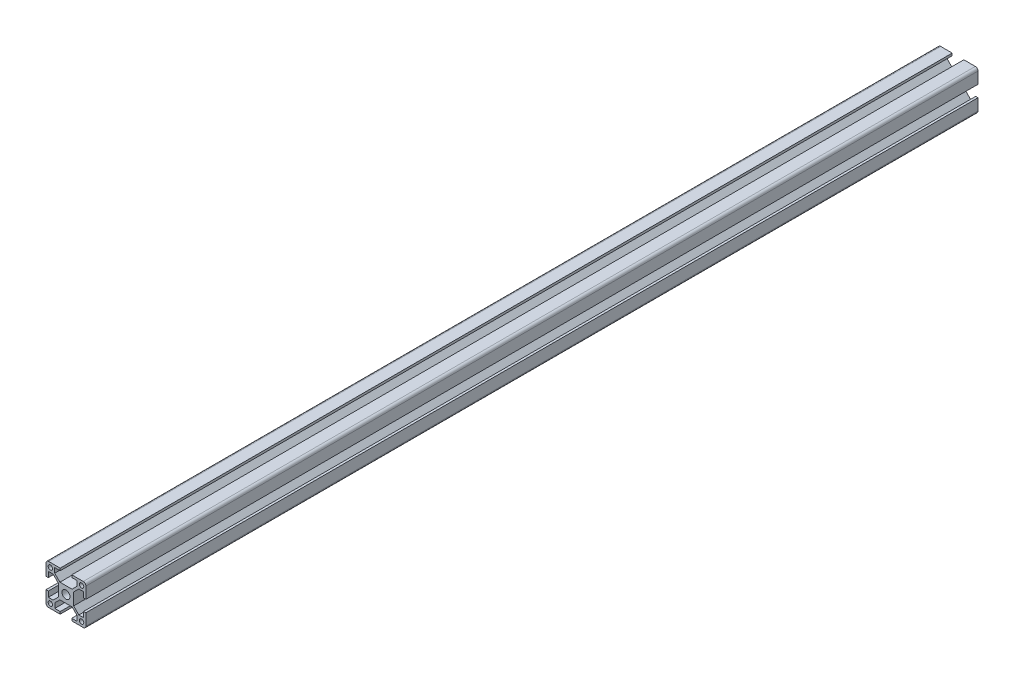
from build123d import *

# Parameters (mm, degrees)
SKETCH1_R           = 3
SKETCH1_R_2         = 1.65
BOSS_EXTRUDE1_DEPTH = 670
FILLET1_R           = 2


with BuildPart() as part:
    # Sketch1 → Boss-Extrude1 (new body)
    with BuildSketch(Plane.XY):
        Polygon((-8.46, 9.66), (-4.55, 5.75), (4.55, 5.75), (8.46, 9.66), (8.46, 13.26), (4.35, 13.26), (4.35, 15), (15, 15), (15, 4.35), (13.26, 4.35), (13.26, 8.46), (9.66, 8.46), (5.75, 4.55), (5.75, -4.55), (9.66, -8.46), (13.26, -8.46), (13.26, -4.35), (15, -4.35), (15, -15), (4.35, -15), (4.35, -13.26), (8.46, -13.26), (8.46, -9.59186747), (4.61813253, -5.75), (-4.578313253, -5.75), (-8.420180723, -9.59186747), (-8.420180723, -13.26), (-4.35, -13.26), (-4.35, -15), (-15, -15), (-15, -4.35), (-13.26, -4.35), (-13.26, -8.46), (-9.66, -8.46), (-5.75, -4.55), (-5.75, 4.55), (-9.66, 8.46), (-13.26, 8.46), (-13.26, 4.35), (-15, 4.35), (-15, 15), (-4.35, 15), (-4.35, 13.26), (-8.46, 13.26), align=None)
        Circle(SKETCH1_R, mode=Mode.SUBTRACT)
        with Locations((11.73, 11.73)):
            Circle(SKETCH1_R_2, mode=Mode.SUBTRACT)
        with Locations((11.73, -11.73)):
            Circle(SKETCH1_R_2, mode=Mode.SUBTRACT)
        with Locations((-11.73, -11.73)):
            Circle(SKETCH1_R_2, mode=Mode.SUBTRACT)
        with Locations((-11.73, 11.73)):
            Circle(SKETCH1_R_2, mode=Mode.SUBTRACT)
    extrude(amount=BOSS_EXTRUDE1_DEPTH)

    # Fillet1
    fillet1_edges = [part.edges().sort_by_distance(p)[0] for p in [
        (-15, -15, 335),
        (15, -15, 335),
        (15, 15, 335),
        (-15, 15, 335),
    ]]
    fillet(fillet1_edges, radius=FILLET1_R)


solid = part.part
